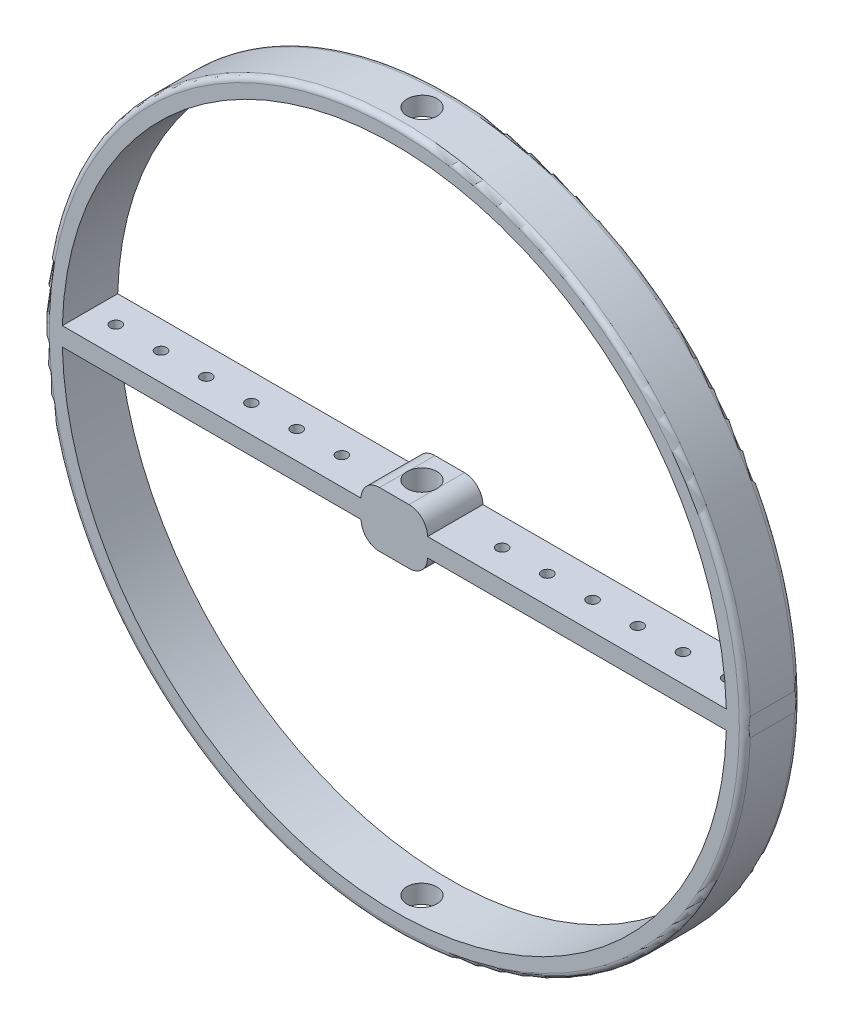
from build123d import *

# Parameters (mm, degrees)
SKETCH1_W               = 18
SKETCH1_H               = 5
BOSS_EXTRUDE1_DEPTH     = 15
SKETCH2_R               = 1.5
CUT_EXTRUDE1_DEPTH      = 20
SKETCH3_R               = 1.5
CUT_EXTRUDE2_DEPTH      = 15
CUT_EXTRUDE3_DEPTH      = 290
CUT_EXTRUDE3_DEPTH_BACK = 330
SKETCH4_R               = 4.05
LPATTERN3_COUNT         = 6
LPATTERN3_PITCH         = 12.25
LPATTERN4_COUNT         = 6
LPATTERN4_PITCH         = 12.25
FILLET1_R               = 5
FILLET2_R               = 5
FILLET3_R               = 5
FILLET4_R               = 5
FILLET5_R               = 1.5
FILLET6_R               = 1.5


# Some blends are built 0.0001 mm under size
with BuildPart() as part:
    # Sketch1 → Boss-Extrude1 (new body)
    with BuildSketch(Plane.XY):
        with BuildLine():
            ThreePointArc((94.967099566, 2.5), (0, 95), (-94.967099566, 2.5))
            Line((-94.967099566, 2.5), (-89.965271077, 2.5))
            ThreePointArc((-89.965271077, 2.5), (0, 90), (89.965271077, 2.5))
            Line((89.965271077, 2.5), (94.967099566, 2.5))
        make_face()
        with BuildLine():
            Line((-89.965271077, -2.5), (-94.967099566, -2.5))
            ThreePointArc((-94.967099566, -2.5), (0, -95), (94.967099566, -2.5))
            Line((94.967099566, -2.5), (89.965271077, -2.5))
            ThreePointArc((89.965271077, -2.5), (0, -90), (-89.965271077, -2.5))
        make_face()
        with BuildLine():
            Line((-94.967099566, 2.5), (-94.967099566, -2.5))
            Line((-94.967099566, -2.5), (-89.965271077, -2.5))
            ThreePointArc((-89.965271077, -2.5), (-90, 0), (-89.965271077, 2.5))
            Line((-89.965271077, 2.5), (-94.967099566, 2.5))
        make_face()
        with BuildLine():
            ThreePointArc((-89.965271077, 2.5), (-90, 0), (-89.965271077, -2.5))
            Line((-89.965271077, -2.5), (-9, -2.5))
            Line((-9, -2.5), (-9, 2.5))
            Line((-9, 2.5), (-89.965271077, 2.5))
        make_face()
        with BuildLine():
            Line((9, -2.5), (89.965271077, -2.5))
            ThreePointArc((89.965271077, -2.5), (89.99131735, -1.250120604), (90, 0))
            ThreePointArc((90, 0), (89.99131735, 1.250120604), (89.965271077, 2.5))
            Line((89.965271077, 2.5), (9, 2.5))
            Line((9, 2.5), (9, -2.5))
        make_face()
        with BuildLine():
            Line((89.965271077, -2.5), (94.967099566, -2.5))
            Line((94.967099566, -2.5), (94.967099566, 2.5))
            Line((94.967099566, 2.5), (89.965271077, 2.5))
            ThreePointArc((89.965271077, 2.5), (89.99131735, 1.250120604), (90, 0))
            ThreePointArc((90, 0), (89.99131735, -1.250120604), (89.965271077, -2.5))
        make_face()
        Rectangle(SKETCH1_W, SKETCH1_H)
        with Locations((0, 5)):
            Rectangle(SKETCH1_W, SKETCH1_H)
        with Locations((0, -5)):
            Rectangle(SKETCH1_W, SKETCH1_H)
    extrude(amount=BOSS_EXTRUDE1_DEPTH)

    # Sketch2 → Cut-Extrude1 (cut)
    with BuildSketch(Plane(origin=(0, 2.5, 0), x_dir=(1, 0, 0), z_dir=(0, 1, 0))):
        with Locations(Location((-82.965271077, -7.5, 0), (0, 0, 270))):
            Circle(SKETCH2_R)
    cut_extrude1 = extrude(amount=-CUT_EXTRUDE1_DEPTH, mode=Mode.SUBTRACT)

    # Sketch3 → Cut-Extrude2 (cut)
    with BuildSketch(Plane(origin=(0, 2.5, 0), x_dir=(1, 0, 0), z_dir=(0, 1, 0))):
        with Locations(Location((82.965271077, -7.5, 0), (0, 0, 270))):
            Circle(SKETCH3_R)
    cut_extrude2 = extrude(amount=-CUT_EXTRUDE2_DEPTH, mode=Mode.SUBTRACT)

    # Sketch4 → Cut-Extrude3 (cut, two sides: drawn at the far end of the back side and taken through both)
    with BuildSketch(Plane(origin=(0, 7.5, 0), x_dir=(1, 0, 0), z_dir=(0, 1, 0)).offset(-CUT_EXTRUDE3_DEPTH_BACK)):
        with Locations(Location((0, -7.5, 0), (0, 0, 90))):
            Circle(SKETCH4_R)
    extrude(amount=CUT_EXTRUDE3_DEPTH + CUT_EXTRUDE3_DEPTH_BACK, mode=Mode.SUBTRACT)

    # LPattern3: Cut-Extrude2 ×6
    with Locations(*[(-i * LPATTERN3_PITCH, 0, 0) for i in range(1, LPATTERN3_COUNT)]):
        add(cut_extrude2, mode=Mode.SUBTRACT)

    # LPattern4: Cut-Extrude1 ×6
    with Locations(*[(i * LPATTERN4_PITCH, 0, 0) for i in range(1, LPATTERN4_COUNT)]):
        add(cut_extrude1, mode=Mode.SUBTRACT)

    # Fillet1
    fillet1_edges = [part.edges().sort_by_distance(p)[0] for p in [
        (-9, 7.5, 7.5),
    ]]
    fillet(fillet1_edges, radius=FILLET1_R - 0.0001)  # a hair under: the kernel refuses the full size

    # Fillet2
    fillet2_edges = [part.edges().sort_by_distance(p)[0] for p in [
        (9, 7.5, 7.5),
    ]]
    fillet(fillet2_edges, radius=FILLET2_R - 0.0001)  # a hair under: the kernel refuses the full size

    # Fillet3
    fillet3_edges = [part.edges().sort_by_distance(p)[0] for p in [
        (9, -7.5, 7.5),
    ]]
    fillet(fillet3_edges, radius=FILLET3_R - 0.0001)  # a hair under: the kernel refuses the full size

    # Fillet4
    fillet4_edges = [part.edges().sort_by_distance(p)[0] for p in [
        (-9, -7.5, 7.5),
    ]]
    fillet(fillet4_edges, radius=FILLET4_R - 0.0001)  # a hair under: the kernel refuses the full size

    # Fillet5
    # the kernel refuses this fillet: 1.5 mm, written as the material it takes off along each edge
    with BuildSketch(Plane(origin=(0, 0, 15), x_dir=(-0.9999126669586381, 0.013215841088011512, 0), z_dir=(0.013215841088011512, 0.9999126669586381, 0))) as fillet5_piece_1:
        with BuildLine():
            CenterArc((95 - FILLET5_R, -FILLET5_R), FILLET5_R, 0, 90)
            Line((95 - FILLET5_R, 0), (95, 0))
            Line((95, 0), (95, -FILLET5_R))
        make_face()
    revolve(axis=Axis((0, 0, 15), (0, 0, 1)), revolution_arc=181.514467922, mode=Mode.SUBTRACT)
    with BuildSketch(Plane(origin=(0, 0, 15), x_dir=(0.9999126669586381, -0.013215841088011463, 0), z_dir=(-0.013215841088011463, -0.9999126669586381, 0))) as fillet5_piece_2:
        with BuildLine():
            CenterArc((95 - FILLET5_R, -FILLET5_R), FILLET5_R, 0, 90)
            Line((95 - FILLET5_R, 0), (95, 0))
            Line((95, 0), (95, -FILLET5_R))
        make_face()
    revolve(axis=Axis((0, 0, 15), (0, 0, 1)), revolution_arc=181.514467922, mode=Mode.SUBTRACT)

    # Fillet6
    # the kernel refuses this fillet: 1.5 mm, written as the material it takes off along each edge
    with BuildSketch(Plane(origin=(0, 0, 0), x_dir=(0.9999126669586381, -0.013215841088011463, 0), z_dir=(-0.013215841088011463, -0.9999126669586381, 0))) as fillet6_piece_1_section:
        with BuildLine():
            CenterArc((95 - FILLET6_R, FILLET6_R), FILLET6_R, 270, 90)
            Line((95, FILLET6_R), (95 + FILLET6_R * 0.02, FILLET6_R))
            Line((95 + FILLET6_R * 0.02, FILLET6_R), (95 + FILLET6_R * 0.02, -FILLET6_R * 0.02))
            Line((95 + FILLET6_R * 0.02, -FILLET6_R * 0.02), (95 - FILLET6_R, -FILLET6_R * 0.02))
            Line((95 - FILLET6_R, -FILLET6_R * 0.02), (95 - FILLET6_R, 0))
        make_face()
    fillet6_piece_1 = revolve(axis=Axis((0, 0, 0), (0, 0, 1)), revolution_arc=181.514467922, mode=Mode.PRIVATE)
    fillet6_piece_1 = split(fillet6_piece_1, bisect_by=Plane(origin=(-94.967099566, 94.599989904, 0.400010096), z_dir=(1, 0, 0)), keep=Keep.TOP, mode=Mode.PRIVATE)
    fillet6_piece_1 = split(fillet6_piece_1, bisect_by=Plane(origin=(94.967099566, 94.599989904, 0.400010096), z_dir=(-1, 0, 0)), keep=Keep.TOP, mode=Mode.PRIVATE)
    with BuildSketch(Plane(origin=(0, 0, 0), x_dir=(-0.9999126669586381, 0.013215841088011512, 0), z_dir=(0.013215841088011512, 0.9999126669586381, 0))) as fillet6_piece_2_section:
        with BuildLine():
            CenterArc((95 - FILLET6_R, FILLET6_R), FILLET6_R, 270, 90)
            Line((95, FILLET6_R), (95 + FILLET6_R * 0.02, FILLET6_R))
            Line((95 + FILLET6_R * 0.02, FILLET6_R), (95 + FILLET6_R * 0.02, -FILLET6_R * 0.02))
            Line((95 + FILLET6_R * 0.02, -FILLET6_R * 0.02), (95 - FILLET6_R, -FILLET6_R * 0.02))
            Line((95 - FILLET6_R, -FILLET6_R * 0.02), (95 - FILLET6_R, 0))
        make_face()
    fillet6_piece_2 = revolve(axis=Axis((0, 0, 0), (0, 0, 1)), revolution_arc=181.514467922, mode=Mode.PRIVATE)
    fillet6_piece_2 = split(fillet6_piece_2, bisect_by=Plane(origin=(-94.967099566, -94.599989904, 0.400010096), z_dir=(1, 0, 0)), keep=Keep.TOP, mode=Mode.PRIVATE)
    fillet6_piece_2 = split(fillet6_piece_2, bisect_by=Plane(origin=(94.967099566, -94.599989904, 0.400010096), z_dir=(-1, 0, 0)), keep=Keep.TOP, mode=Mode.PRIVATE)
    add([fillet6_piece_1, fillet6_piece_2], mode=Mode.SUBTRACT)


solid = part.part
